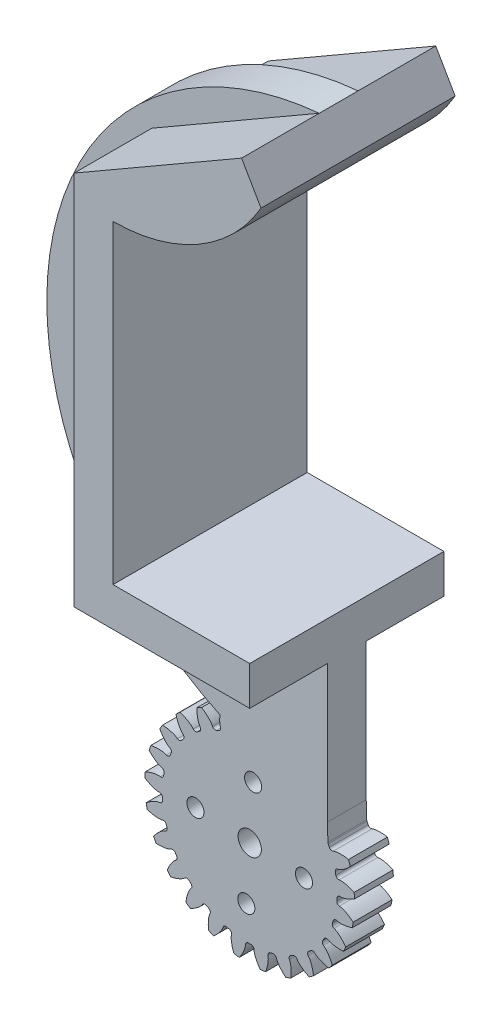
from build123d import *

# Parameters (mm, degrees)
SKETCH_1_R           = 13.5
LASHENA_DEPTH        = 5
CUT_EXTRUDEA_DEPTH   = 30
WWW_KYTOOL_CN_COUNT  = 25
EXTRUDE_2_DEPTH      = 10
EXTRUDE_2_DEPTH_BACK = 15
CUT_EXTRUDE_START    = -10
CUT_EXTRUDE_2_DEPTH  = 10
EXTRUDE_3_DEPTH      = 5
CUT_EXTRUDE_3_DEPTH  = 10
SKETCH_12_R          = 1.5
SKETCH_12_R_2        = 1.1
CUT_EXTRUDE_4_DEPTH  = 128.558620821
EXTRUDE_4_DEPTH      = 5
CUT_EXTRUDE_5_DEPTH  = 10


with BuildPart() as part:
    # 草图1 → LaShenA (new body)
    with BuildSketch(Plane.XY):
        Circle(SKETCH_1_R)
    extrude(amount=LASHENA_DEPTH)

    # SketchA → Cut-ExtrudeA (cut)
    with BuildSketch(Plane.XY.offset(5)):
        with BuildLine():
            ThreePointArc((-3.984350063, 10.520810547), (-4.141401218, 10.459985466), (-4.297524216, 10.396816129))
            ThreePointArc((-4.297524216, 10.396816129), (-4.579677411, 10.393549891), (-4.786294021, 10.585723434))
            add(Edge.make_bspline(
                [(-4.786294021, 10.585723434), (-4.804689966, 10.624676134), (-4.836949244, 10.69266095), (-4.880435936, 10.771422965), (-4.914918146, 10.825150817), (-4.943317749, 10.867301695), (-4.977370459, 10.915048119), (-5.017326263, 10.968161569), (-5.063499475, 11.026352218), (-5.116169679, 11.089334691), (-5.175613294, 11.156807226), (-5.24209304, 11.228458772), (-5.315860723, 11.303967278), (-5.397155902, 11.383000734), (-5.486205826, 11.465217384), (-5.583225013, 11.550266205), (-5.688414947, 11.637787319), (-5.801963757, 11.727412442), (-5.924045932, 11.818765334), (-6.05482202, 11.911462258), (-6.194438398, 12.005112443), (-6.343026893, 12.099318618), (-6.557737569, 12.227806993), (-6.725924413, 12.319640738), (-6.841804759, 12.379242901)],
                knots=[0.117691322, 0.117691322, 0.117691322, 0.117691322, 0.158671831, 0.189773021, 0.203463493, 0.219643142, 0.238311966, 0.259469968, 0.283117146, 0.3092535, 0.337879031, 0.368993739, 0.402597623, 0.438690683, 0.47727292, 0.518344334, 0.561904924, 0.60795469, 0.656493633, 0.707521753, 0.761039049, 0.817045522, 0.875541172, 1, 1, 1, 1], degree=3))
            ThreePointArc((-6.841804759, 12.379242901), (-5.206795461, 13.150864161), (-3.486713877, 13.707617353))
            add(Edge.make_bspline(
                [(-3.757368158, 10.993104002), (-3.770623049, 11.034092189), (-3.793645857, 11.105733983), (-3.815861732, 11.19291771), (-3.827504528, 11.255688326), (-3.83565637, 11.305855859), (-3.843517689, 11.363972189), (-3.85074982, 11.430041857), (-3.856925238, 11.504068754), (-3.861644781, 11.586036236), (-3.864500379, 11.675913552), (-3.865087588, 11.773653798), (-3.863002391, 11.879194584), (-3.85784288, 11.992457874), (-3.849209448, 12.1133501), (-3.836705428, 12.241762226), (-3.819937593, 12.377569837), (-3.798516691, 12.52063325), (-3.772057973, 12.670797641), (-3.740181719, 12.827893183), (-3.702513722, 12.991735218), (-3.658685936, 13.162124388), (-3.590124934, 13.402767955), (-3.530386525, 13.584843691), (-3.486713877, 13.707617353)],
                knots=[0.117691322, 0.117691322, 0.117691322, 0.117691322, 0.158671831, 0.189773021, 0.203463493, 0.219643142, 0.238311966, 0.259469968, 0.283117146, 0.3092535, 0.337879031, 0.368993739, 0.402597623, 0.438690683, 0.47727292, 0.518344334, 0.561904924, 0.60795469, 0.656493633, 0.707521753, 0.761039049, 0.817045522, 0.875541172, 1, 1, 1, 1], degree=3))
            ThreePointArc((-3.757368158, 10.993104002), (-3.776433342, 10.711576716), (-3.984350063, 10.520810547))
        make_face()
    cut_extrudea = extrude(amount=-CUT_EXTRUDEA_DEPTH, mode=Mode.SUBTRACT)

    # www.KYTool.cn: Cut-ExtrudeA ×25 about axis
    www_kytool_cn_axis = Axis((0, 0, -88.99), (0, 0, 1))
    for i in range(1, WWW_KYTOOL_CN_COUNT):
        add(cut_extrudea.rotate(www_kytool_cn_axis, i * 360 / WWW_KYTOOL_CN_COUNT), mode=Mode.SUBTRACT)

    # 草图4 → 凸台-拉伸2 (add, two sides: drawn at the far end of the back side and taken through both)
    with BuildSketch(Plane(origin=(-1.008617318, -38.329057813, 5), x_dir=(1, 0, 0), z_dir=(0, 0, 1)).offset(-EXTRUDE_2_DEPTH_BACK)):
        with BuildLine():
            Line((11.008617318, 38.329057813), (11.008617318, 68.329057813))
            Line((11.008617318, 68.329057813), (-6.591382682, 68.329057813))
            Line((-6.591382682, 68.329057813), (-6.591382682, 108.829057813))
            ThreePointArc((-6.591382682, 108.829057813), (4.408617318, 111.77649893), (12.461176202, 119.829057813))
            Line((12.461176202, 119.829057813), (9.961176202, 124.159184832))
            Line((9.961176202, 124.159184832), (-11.591382682, 111.715809159))
            Line((-11.591382682, 111.715809159), (-11.591382682, 63.329057813))
            Line((-11.591382682, 63.329057813), (6.008617318, 63.329057813))
            Line((6.008617318, 63.329057813), (6.008617318, 46.989311851))
            ThreePointArc((6.008617318, 46.989311851), (9.668871356, 43.329057813), (11.008617318, 38.329057813))
        make_face()
    extrude(amount=EXTRUDE_2_DEPTH + EXTRUDE_2_DEPTH_BACK)

    # 草图6 → 切除-拉伸2 (cut)
    with BuildSketch(Plane(origin=(-1.008617318, -38.329057813, 15), x_dir=(1, 0, 0), z_dir=(0, 0, 1)).offset(CUT_EXTRUDE_START)):
        with BuildLine():
            Line((11.008617318, 38.329057813), (11.008617318, 63.329057813))
            Line((11.008617318, 63.329057813), (6.008617318, 63.329057813))
            Line((6.008617318, 63.329057813), (6.008617318, 46.989311851))
            ThreePointArc((6.008617318, 46.989311851), (9.668871356, 43.329057813), (11.008617318, 38.329057813))
        make_face()
    extrude(amount=CUT_EXTRUDE_2_DEPTH, mode=Mode.SUBTRACT)

    # 草图8 → 凸台-拉伸3 (add)
    with BuildSketch(Plane(origin=(-1.008617318, -38.329057813, 5), x_dir=(1, 0, 0), z_dir=(0, 0, 1))):
        with BuildLine():
            Line((-11.591382682, 111.715809159), (9.961176202, 124.159184832))
            ThreePointArc((9.961176202, 124.159184832), (-25.062056366, 87.696978372), (6.008617318, 47.812989652))
            Line((6.008617318, 47.812989652), (6.008617318, 63.329057813))
            Line((6.008617318, 63.329057813), (-11.591382682, 63.329057813))
            Line((-11.591382682, 63.329057813), (-11.591382682, 111.715809159))
        make_face()
    extrude(amount=-EXTRUDE_3_DEPTH)

    # 草图10 → 切除-拉伸3 (cut)
    with BuildSketch(Plane(origin=(-1.008617318, -38.329057813, -10), x_dir=(-1, 0, 0), z_dir=(0, 0, -1))):
        with BuildLine():
            Line((-6.008617318, 63.329057813), (-6.008617318, 46.989311851))
            ThreePointArc((-6.008617318, 46.989311851), (-9.668871356, 43.329057813), (-11.008617318, 38.329057813))
            Line((-11.008617318, 38.329057813), (-11.008617318, 63.329057813))
            Line((-11.008617318, 63.329057813), (-6.008617318, 63.329057813))
        make_face()
    extrude(amount=-CUT_EXTRUDE_3_DEPTH, mode=Mode.SUBTRACT)

    # 草图12 → 切除-拉伸4 (cut, through all)
    with BuildSketch(Plane(origin=(-1.008617318, -38.329057813, 5), x_dir=(1, 0, 0), z_dir=(0, 0, 1))):
        with Locations((1.008617318, 38.329057813)):
            Circle(SKETCH_12_R)
        with Locations((-5.977569781, 38.76859145)):
            Circle(SKETCH_12_R_2)
        with Locations((1.448150955, 45.315244912)):
            Circle(SKETCH_12_R_2)
        with Locations((7.994804417, 37.889524176)):
            Circle(SKETCH_12_R_2)
        with Locations((0.569083682, 31.342870714)):
            Circle(SKETCH_12_R_2)
    extrude(amount=-CUT_EXTRUDE_4_DEPTH, mode=Mode.SUBTRACT)

    # 草图13 → 凸台-拉伸4 (add)
    with BuildSketch(Plane.XY.offset(5)):
        with BuildLine():
            ThreePointArc((-1.242755191, 11.181147505), (-1.171656629, 11.196035655), (-1.104690091, 11.224180731))
            ThreePointArc((-1.104690091, 11.224180731), (-1.570284163, 11.402857707), (-2.033532347, 11.587531535))
            add(Edge.make_bspline(
                [(-2.033532347, 11.587531535), (-2.032082424, 11.581540065), (-2.020815424, 11.533792188), (-2.011492286, 11.485760201), (-2.003361426, 11.443456386)],
                knots=[0.953131762, 0.953131762, 0.953131762, 0.953131762, 0.959019491, 1, 1, 1, 1], degree=3))
            ThreePointArc((-2.003361426, 11.443456386), (-1.851027674, 11.205936868), (-1.57692656, 11.138931844))
            ThreePointArc((-1.57692656, 11.138931844), (-1.409998878, 11.16129039), (-1.242755191, 11.181147505))
        make_face()
    extrude(amount=-EXTRUDE_4_DEPTH)

    # 草图14 → 切除-拉伸5 (cut)
    with BuildSketch(Plane.XY.offset(5).offset(CUT_EXTRUDE_START)):
        with BuildLine():
            Line((10, 7.312754527), (10.068009146, 5.097132041))
            ThreePointArc((10.068009146, 5.097132041), (10.117688156, 5.296956094), (10.264301038, 5.441532437))
            add(Edge.make_bspline(
                [(11.586916571, 6.927724329), (11.534069284, 6.834672524), (11.452818253, 6.699299558), (11.339962754, 6.526885227), (11.257644274, 6.407932871), (11.176900793, 6.29745501), (11.098111682, 6.195287008), (11.021648759, 6.101250377), (10.947875824, 6.015153064), (10.877148228, 5.936789726), (10.809812368, 5.865942126), (10.74620547, 5.802379174), (10.686654468, 5.7458582), (10.631477885, 5.696122279), (10.580978088, 5.652910298), (10.535464068, 5.61592676), (10.495179591, 5.584936522), (10.443722914, 5.547148754), (10.36784687, 5.498802366), (10.302021783, 5.462337942), (10.264301038, 5.441532437)],
                knots=[0.358992653, 0.358992653, 0.358992653, 0.358992653, 0.461197689, 0.509736632, 0.555786399, 0.599346989, 0.640418402, 0.679000639, 0.7150937, 0.748697584, 0.779812291, 0.808437822, 0.834574177, 0.858221354, 0.879379356, 0.898048181, 0.914227829, 0.927918301, 0.959019491, 1, 1, 1, 1], degree=3))
            ThreePointArc((11.586916571, 6.927724329), (11.398426994, 7.233661732), (11.201861514, 7.534474011))
            add(Edge.make_bspline(
                [(10, 7.312754527), (10.033755727, 7.323491623), (10.103822532, 7.344743423), (10.213366196, 7.374899897), (10.331009413, 7.404046768), (10.457000556, 7.431836268), (10.591342816, 7.457855968), (10.73402363, 7.481692506), (10.938080315, 7.510396763), (11.095164443, 7.526275888), (11.201861514, 7.534474011)],
                knots=[0.368766414, 0.368766414, 0.368766414, 0.368766414, 0.402597623, 0.438690683, 0.47727292, 0.518344334, 0.561904924, 0.60795469, 0.656493633, 0.758698669, 0.758698669, 0.758698669, 0.758698669], degree=3))
        make_face()
    extrude(amount=CUT_EXTRUDE_5_DEPTH, mode=Mode.SUBTRACT)


solid = part.part
